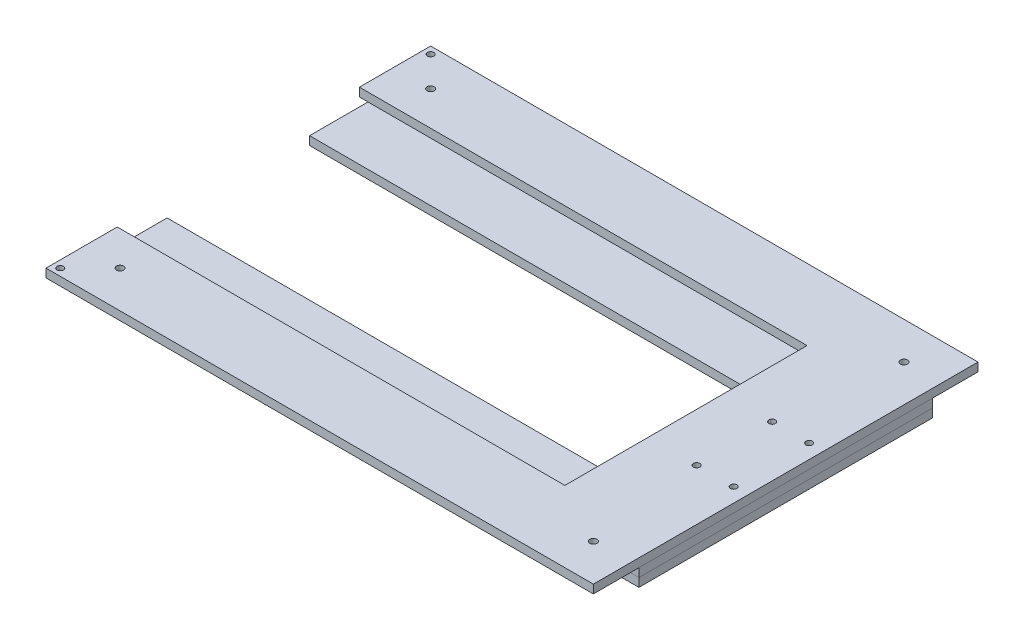
from build123d import *

# Parameters (mm, degrees)
EXTRUDE_2_DEPTH             = 6
EXTRUDE_3_DEPTH             = 6
SKETCH_4_R                  = 2.5
CUT_EXTRUDE_1_DEPTH         = 483.579543495
PATTERN_LINEAR_2_COUNT      = 2
PATTERN_LINEAR_2_PITCH      = 332.2
PATTERN_LINEAR_2_COUNT_DIR2 = 2
PATTERN_LINEAR_2_PITCH_DIR2 = 218
EXTRUDE_4_DEPTH             = 6
SKETCH_6_R                  = 2.25
CUT_EXTRUDE_2_DEPTH         = 483.766005224
SKETCH_7_R                  = 2.25
CUT_EXTRUDE_3_DEPTH         = 483.579543495
SPLIT_START                 = -12
SPLIT_BODIES_1_OUTLINE_R    = 2.25
SPLIT_BODIES_1_DEPTH        = 12
SPLIT_START_2               = -6
SPLIT_BODIES_1_2_OUTLINE_R  = 2.25
SPLIT_BODIES_1_2_DEPTH      = 6
SPLIT_BODIES_1_3_OUTLINE_R  = 2.25
SPLIT_BODIES_1_3_DEPTH      = 6


# Read off the part's stored shape, not the designer's step: Разделить1
with BuildPart() as part:
    # Эскиз1 → Бобышка-Вытянуть2 (new body)
    with BuildSketch(Plane(origin=(0, 0, 0), x_dir=(1, 0, 0), z_dir=(0, 1, 0))):
        Polygon((50, -77.921508101), (50, -347.921508101), (-334.2, -347.921508101), (-334.2, -297.921508101), (-20, -297.921508101), (-20, -127.921508101), (-334.2, -127.921508101), (-334.2, -77.921508101), align=None)
    extrude(amount=EXTRUDE_2_DEPTH)

    # Эскиз2 → Бобышка-Вытянуть3 (add)
    with BuildSketch(Plane.XZ):
        Polygon((50, 315.921508101), (50, 109.921508101), (-334.2, 109.921508101), (-334.2, 121.921508101), (-14, 121.921508101), (-14, 303.921508101), (-334.2, 303.921508101), (-334.2, 315.921508101), align=None)
    extrude(amount=EXTRUDE_3_DEPTH)

    # Эскиз4 → Вырез-Вытянуть1 (cut, through all)
    with BuildSketch(Plane(origin=(0, 6, 0), x_dir=(1, 0, 0), z_dir=(0, 1, 0))):
        with Locations(Location((-308.2, -103.921508101, 0), (0, 0, 270))):
            Circle(SKETCH_4_R)
    cut_extrude_1 = extrude(amount=-CUT_EXTRUDE_1_DEPTH, mode=Mode.SUBTRACT)

    # Линейный массив2: Cut-Extrude 1 2 × 2
    with Locations(*[(i * PATTERN_LINEAR_2_PITCH, 0, j * PATTERN_LINEAR_2_PITCH_DIR2) for i in range(PATTERN_LINEAR_2_COUNT) for j in range(PATTERN_LINEAR_2_COUNT_DIR2) if (i, j) != (0, 0)]):
        add(cut_extrude_1, mode=Mode.SUBTRACT)

    # Эскиз5 → Бобышка-Вытянуть4 (add)
    with BuildSketch(Plane.XZ.offset(6)):
        Polygon((50, 315.921508101), (-334.2, 315.921508101), (-334.2, 262.921508101), (0, 262.921508101), (0, 162.921508101), (-334.2, 162.921508101), (-334.2, 109.921508101), (50, 109.921508101), align=None)
    extrude(amount=EXTRUDE_4_DEPTH)

    # Эскиз6 → Вырез-Вытянуть2 (cut, through all)
    with BuildSketch(Plane.XZ.offset(12)):
        with Locations(Location((14, 239.421508101, 0), (0, 0, 270))):
            Circle(SKETCH_6_R)
        with Locations(Location((40, 239.421508101, 0), (0, 0, 270))):
            Circle(SKETCH_6_R)
        with Locations(Location((40, 186.421508101, 0), (0, 0, 270))):
            Circle(SKETCH_6_R)
        with Locations(Location((14, 186.421508101, 0), (0, 0, 270))):
            Circle(SKETCH_6_R)
    extrude(amount=-CUT_EXTRUDE_2_DEPTH, mode=Mode.SUBTRACT)

    # Эскиз7 → Вырез-Вытянуть3 (cut, through all)
    with BuildSketch(Plane.XZ):
        with Locations(Location((-329.2, 342.921508101, 0), (0, 0, 270))):
            Circle(SKETCH_7_R)
        with Locations(Location((-329.2, 82.921508101, 0), (0, 0, 270))):
            Circle(SKETCH_7_R)
    extrude(amount=-CUT_EXTRUDE_3_DEPTH, mode=Mode.SUBTRACT)

    # Split Bodies 1 outline → Split Bodies 1 (cut)
    with BuildSketch(Plane(origin=(0, 0, 0), x_dir=(1, 0, 0), z_dir=(0, 1, 0)).offset(SPLIT_START)):
        Polygon((-334.2, -162.921508101), (-14, -162.921508101), (-14, -262.921508101), (-334.2, -262.921508101), (-334.2, -315.921508101), (50, -315.921508101), (50, -109.921508101), (-334.2, -109.921508101), align=None)
        with Locations((14, -186.421508101)):
            Circle(SPLIT_BODIES_1_OUTLINE_R, mode=Mode.SUBTRACT)
        with Locations((40, -186.421508101)):
            Circle(SPLIT_BODIES_1_OUTLINE_R, mode=Mode.SUBTRACT)
        with Locations((14, -239.421508101)):
            Circle(SPLIT_BODIES_1_OUTLINE_R, mode=Mode.SUBTRACT)
        with Locations((40, -239.421508101)):
            Circle(SPLIT_BODIES_1_OUTLINE_R, mode=Mode.SUBTRACT)
    extrude(amount=SPLIT_BODIES_1_DEPTH, mode=Mode.SUBTRACT)


with BuildPart() as body_2:
    # Split Bodies 1 2 outline → Split Bodies 1 2 (new body)
    with BuildSketch(Plane(origin=(0, 0, 0), x_dir=(1, 0, 0), z_dir=(0, 1, 0)).offset(SPLIT_START_2)):
        Polygon((-334.2, -303.921508101), (-334.2, -315.921508101), (50, -315.921508101), (50, -109.921508101), (-334.2, -109.921508101), (-334.2, -121.921508101), (-14, -121.921508101), (-14, -303.921508101), align=None)
        with Locations((14, -239.421508101)):
            Circle(SPLIT_BODIES_1_2_OUTLINE_R, mode=Mode.SUBTRACT)
        with Locations((40, -239.421508101)):
            Circle(SPLIT_BODIES_1_2_OUTLINE_R, mode=Mode.SUBTRACT)
        with Locations((14, -186.421508101)):
            Circle(SPLIT_BODIES_1_2_OUTLINE_R, mode=Mode.SUBTRACT)
        with Locations((40, -186.421508101)):
            Circle(SPLIT_BODIES_1_2_OUTLINE_R, mode=Mode.SUBTRACT)
    extrude(amount=SPLIT_BODIES_1_2_DEPTH)


with BuildPart() as body_3:
    # Split Bodies 1 3 outline → Split Bodies 1 3 (new body)
    with BuildSketch(Plane(origin=(0, 0, 0), x_dir=(1, 0, 0), z_dir=(0, 1, 0)).offset(SPLIT_START)):
        Polygon((50, -315.921508101), (50, -109.921508101), (-334.2, -109.921508101), (-334.2, -162.921508101), (0, -162.921508101), (0, -262.921508101), (-334.2, -262.921508101), (-334.2, -315.921508101), align=None)
        with Locations((14, -239.421508101)):
            Circle(SPLIT_BODIES_1_3_OUTLINE_R, mode=Mode.SUBTRACT)
        with Locations((40, -239.421508101)):
            Circle(SPLIT_BODIES_1_3_OUTLINE_R, mode=Mode.SUBTRACT)
        with Locations((14, -186.421508101)):
            Circle(SPLIT_BODIES_1_3_OUTLINE_R, mode=Mode.SUBTRACT)
        with Locations((40, -186.421508101)):
            Circle(SPLIT_BODIES_1_3_OUTLINE_R, mode=Mode.SUBTRACT)
    extrude(amount=SPLIT_BODIES_1_3_DEPTH)


solid = Compound([part.part, body_2.part, body_3.part])
